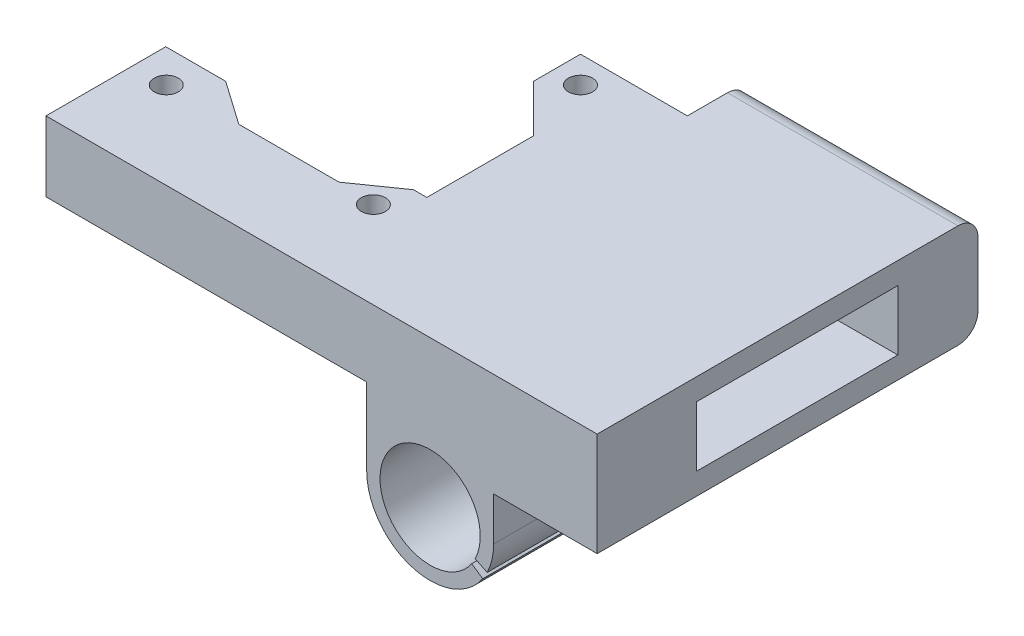
from build123d import *

# Parameters (mm, degrees)
SKETCH1_R               = 1.8
BOSS_EXTRUDE1_DEPTH     = 31.5
CUT_EXTRUDE1_DEPTH      = 16
FILLET1_R               = 3
CUT_EXTRUDE2_DEPTH      = 101.511193407
CUT_EXTRUDE2_DEPTH_BACK = 101.511193407
SKETCH5_W               = 48
SKETCH5_H               = 48
CUT_EXTRUDE3_DEPTH      = 21
SKETCH6_W               = 30.142
SKETCH6_H               = 9
CUT_EXTRUDE4_DEPTH      = 31.4
SKETCH7_W               = 21
SKETCH7_H               = 9
CUT_EXTRUDE5_DEPTH      = 83.779586925
SKETCH8_R               = 3.5
CUT_EXTRUDE6_DEPTH      = 1.5


with BuildPart() as part:
    # Sketch1 → Boss-Extrude1 (new body)
    with BuildSketch(Plane(origin=(0, 0, 0), x_dir=(1, 0, 0), z_dir=(0, 1, 0))):
        Polygon((0, 17.928932188), (0, 0), (82.5, 0), (82.5, 57), (48, 57), (48, 48), (32, 48), (32, 41), (39.071067812, 33.928932188), (39.071067812, 17.928932188), (37.071067812, 17.928932188), (30.517851458, 13.340320697), (15.517851458, 13.340320697), (8.964635103, 17.928932188), align=None)
        with Locations((5, 13)):
            Circle(SKETCH1_R, mode=Mode.SUBTRACT)
        with Locations((36, 13)):
            Circle(SKETCH1_R, mode=Mode.SUBTRACT)
        with Locations((36, 44)):
            Circle(SKETCH1_R, mode=Mode.SUBTRACT)
    extrude(amount=BOSS_EXTRUDE1_DEPTH)

    # Sketch2 → Cut-Extrude1 (cut)
    with BuildSketch(Plane.XZ):
        Polygon((82.5, -57), (82.5, 0), (67, 0), (67, -48), (48, -48), (48, -57), align=None)
    extrude(amount=-CUT_EXTRUDE1_DEPTH, mode=Mode.SUBTRACT)

    # Fillet1
    fillet1_edges = [part.edges().sort_by_distance(p)[0] for p in [
        (65.25, 31.5, -57),
        (65.25, 16, -57),
    ]]
    fillet(fillet1_edges, radius=FILLET1_R)

    # Sketch3 → Cut-Extrude2 (cut, two sides: drawn at the far end of the back side and taken through both)
    with BuildSketch(Plane(origin=(0, 0, -48), x_dir=(-1, 0, 0), z_dir=(0, 0, -1)).offset(-CUT_EXTRUDE2_DEPTH_BACK)):
        with BuildLine():
            Line((-65.375856939, 4.187667417), (-63.717781794, 5.306053224))
            ThreePointArc((-63.717781794, 5.306053224), (-51.004809472, 13.25), (-64.240955347, 6.212216399))
            Line((-64.240955347, 6.212216399), (-66.03854344, 5.335474106))
            ThreePointArc((-66.03854344, 5.335474106), (-66.756515615, 7.362964984), (-67, 9.5))
            Line((-67, 9.5), (-67, 0))
            Line((-67, 0), (-57.5, 0))
            ThreePointArc((-57.5, 0), (-61.959979846, 1.111997868), (-65.375856939, 4.187667417))
        make_face()
        with BuildLine():
            ThreePointArc((-48, 9.5), (-50.782485579, 2.782485579), (-57.5, 0))
            Line((-57.5, 0), (-48, 0))
            Line((-48, 0), (-48, 9.5))
        make_face()
    extrude(amount=CUT_EXTRUDE2_DEPTH + CUT_EXTRUDE2_DEPTH_BACK, mode=Mode.SUBTRACT)

    # Sketch5 → Cut-Extrude3 (cut)
    with BuildSketch(Plane.XZ):
        with Locations((24, -24)):
            Rectangle(SKETCH5_W, SKETCH5_H)
    extrude(amount=-CUT_EXTRUDE3_DEPTH, mode=Mode.SUBTRACT)

    # Sketch6 → Cut-Extrude4 (cut)
    with BuildSketch(Plane(origin=(82.5, 0, 0), x_dir=(0, 0, -1), z_dir=(1, 0, 0))):
        with Locations((29.929, 23.75)):
            Rectangle(SKETCH6_W, SKETCH6_H)
    extrude(amount=-CUT_EXTRUDE4_DEPTH, mode=Mode.SUBTRACT)

    # Sketch7 → Cut-Extrude5 (cut, through all)
    with BuildSketch(Plane(origin=(51.1, 0, 0), x_dir=(0, 0, -1), z_dir=(1, 0, 0))):
        with Locations((28.428932188, 23.75)):
            Rectangle(SKETCH7_W, SKETCH7_H)
    extrude(amount=-CUT_EXTRUDE5_DEPTH, mode=Mode.SUBTRACT)

    # Sketch8 → Cut-Extrude6 (cut)
    with BuildSketch(Plane.XZ.offset(-21)):
        with Locations((5, -13)):
            Circle(SKETCH8_R)
        with Locations((36, -13)):
            Circle(SKETCH8_R)
        with Locations((36, -44)):
            Circle(SKETCH8_R)
    extrude(amount=-CUT_EXTRUDE6_DEPTH, mode=Mode.SUBTRACT)


solid = part.part
